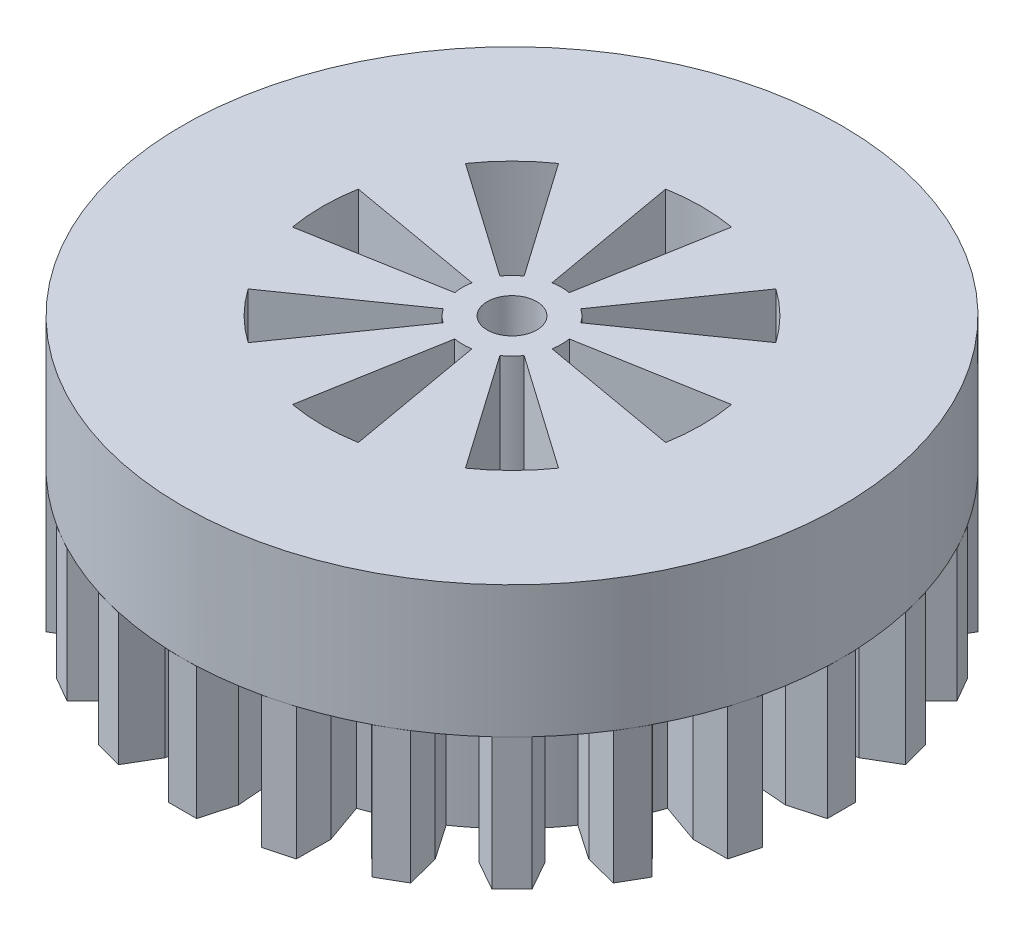
from build123d import *
from build123d.topology import SkipClean

# Parameters (mm, degrees)
SKETCH1_R           = 15.5
BOSS_EXTRUDE1_DEPTH = 8
BOSS_EXTRUDE2_START = -8
BOSS_EXTRUDE2_DEPTH = 8
CHAMFER1_SIZE       = 2
CHAMFER1_SIZE2      = 0.709896962
CHAMFER2_SIZE       = 2
CHAMFER2_SIZE2      = 0.709896962
CIRPATTERN1_DEPTH   = 8
SKETCH3_R           = 20
BOSS_EXTRUDE3_DEPTH = 8
SKETCH4_R           = 3
BOSS_EXTRUDE4_DEPTH = 7
CUT_EXTRUDE1_DEPTH  = 33.496153619
CIRPATTERN2_COUNT   = 8
SKETCH6_R           = 1.5
CUT_EXTRUDE2_DEPTH  = 37.455452267


# Read off the part's stored shape, not the designer's step: CirPattern1
with BuildPart() as part:
    # Sketch1 → Boss-Extrude1 (new body)
    with BuildSketch(Plane(origin=(0, 0, 0), x_dir=(1, 0, 0), z_dir=(0, 1, 0))):
        with Locations(Location((0, 0, 0), (0, 0, 270))):
            Circle(SKETCH1_R)
    extrude(amount=BOSS_EXTRUDE1_DEPTH)

    # Sketch2 → Boss-Extrude2 (add)
    with BuildSketch(Plane(origin=(0, 8, 0), x_dir=(1, 0, 0), z_dir=(0, 1, 0)).offset(BOSS_EXTRUDE2_START)):
        with BuildLine():
            ThreePointArc((-15.452462155, -1.213018279), (-15.488110979, -0.60697471), (-15.5, 0))
            Line((-15.5, 0), (-20, 0))
            Line((-20, 0), (-20, -1.57))
            Line((-20, -1.57), (-15.452462155, -1.213018279))
        make_face()
        with BuildLine():
            Line((-20, 0), (-15.5, 0))
            ThreePointArc((-15.5, 0), (-15.488110979, 0.60697471), (-15.452462155, 1.213018279))
            Line((-15.452462155, 1.213018279), (-20, 1.57))
            Line((-20, 1.57), (-20, 0))
        make_face()
        with BuildLine():
            Line((-15.5, 0), (0, 0))
            Line((0, 0), (-15.452462155, 1.213018279))
            ThreePointArc((-15.452462155, 1.213018279), (-15.488110979, 0.60697471), (-15.5, 0))
        make_face()
        with BuildLine():
            Line((-15.452462155, -1.213018279), (0, 0))
            Line((0, 0), (-15.5, 0))
            ThreePointArc((-15.5, 0), (-15.488110979, -0.60697471), (-15.452462155, -1.213018279))
        make_face()
    extrude(amount=BOSS_EXTRUDE2_DEPTH)

    # Chamfer1
    chamfer1_edges = [part.edges().sort_by_distance(p)[0] for p in [
        (-20, 4, 1.57),
    ]]
    chamfer1_side = [part.faces().sort_by_distance(p)[0] for p in [
        (-17.726231078, 4, 1.39150914),
    ]]
    chamfer(chamfer1_edges, length=CHAMFER1_SIZE, length2=CHAMFER1_SIZE2, reference=chamfer1_side[0])

    # Chamfer2
    chamfer2_edges = [part.edges().sort_by_distance(p)[0] for p in [
        (-20, 4, -1.57),
    ]]
    chamfer2_side = [part.faces().sort_by_distance(p)[0] for p in [
        (-17.726231078, 4, -1.39150914),
    ]]
    chamfer(chamfer2_edges, length=CHAMFER2_SIZE, length2=CHAMFER2_SIZE2, reference=chamfer2_side[0])

    # CirPattern1 outline → CirPattern1 (add)
    with BuildSketch(Plane(origin=(0, 0, 0), x_dir=(1, 0, 0), z_dir=(0, 1, 0))):
        with BuildLine():
            Line((-19.095905479, -6.007176639), (-17.026753845, -6.025648684))
            Line((-17.026753845, -6.025648684), (-14.611980043, -5.171077183))
            ThreePointArc((-14.611980043, -5.171077183), (-14.971850307, -4.011695199), (-15.239884508, -2.827705816))
            Line((-15.239884508, -2.827705816), (-17.758425716, -3.295012088))
            Line((-17.758425716, -3.295012088), (-19.541127573, -4.345585165))
            Line((-19.541127573, -4.345585165), (-19.095905479, -6.007176639))
        make_face()
        with BuildLine():
            ThreePointArc((-15.239884508, 2.827705816), (-14.971850307, 4.011695199), (-14.611980043, 5.171077183))
            Line((-14.611980043, 5.171077183), (-17.026753845, 6.025648684))
            Line((-17.026753845, 6.025648684), (-19.095905479, 6.007176639))
            Line((-19.095905479, 6.007176639), (-19.541127573, 4.345585165))
            Line((-19.541127573, 4.345585165), (-17.758425716, 3.295012088))
            Line((-17.758425716, 3.295012088), (-15.239884508, 2.827705816))
        make_face()
        with BuildLine():
            ThreePointArc((-13.988733917, 6.675726433), (-13.423393758, 7.75), (-12.775715638, 8.776735723))
            Line((-12.775715638, 8.776735723), (-14.887028639, 10.227177855))
            Line((-14.887028639, 10.227177855), (-16.890456557, 10.74487108))
            Line((-16.890456557, 10.74487108), (-17.750559595, 9.25512892))
            Line((-17.750559595, 9.25512892), (-16.300510151, 7.77895606))
            Line((-16.300510151, 7.77895606), (-13.988733917, 6.675726433))
        make_face()
        with BuildLine():
            ThreePointArc((-11.784274227, 10.068807325), (-10.960155108, 10.960155108), (-10.068807325, 11.784274227))
            Line((-10.068807325, 11.784274227), (-11.732777032, 13.731741757))
            Line((-11.732777032, 13.731741757), (-13.533950933, 14.750320314))
            Line((-13.533950933, 14.750320314), (-14.750320314, 13.533950933))
            Line((-14.750320314, 13.533950933), (-13.731741757, 11.732777032))
            Line((-13.731741757, 11.732777032), (-11.784274227, 10.068807325))
        make_face()
        with BuildLine():
            ThreePointArc((-8.776735723, 12.775715638), (-7.75, 13.423393758), (-6.675726433, 13.988733917))
            Line((-6.675726433, 13.988733917), (-7.77895606, 16.300510151))
            Line((-7.77895606, 16.300510151), (-9.25512892, 17.750559595))
            Line((-9.25512892, 17.750559595), (-10.74487108, 16.890456557))
            Line((-10.74487108, 16.890456557), (-10.227177855, 14.887028639))
            Line((-10.227177855, 14.887028639), (-8.776735723, 12.775715638))
        make_face()
        with BuildLine():
            ThreePointArc((-5.171077183, 14.611980043), (-4.011695199, 14.971850307), (-2.827705816, 15.239884508))
            Line((-2.827705816, 15.239884508), (-3.295012088, 17.758425716))
            Line((-3.295012088, 17.758425716), (-4.345585165, 19.541127573))
            Line((-4.345585165, 19.541127573), (-6.007176639, 19.095905479))
            Line((-6.007176639, 19.095905479), (-6.025648684, 17.026753845))
            Line((-6.025648684, 17.026753845), (-5.171077183, 14.611980043))
        make_face()
        with BuildLine():
            ThreePointArc((-1.213018279, 15.452462155), (0, 15.5), (1.213018279, 15.452462155))
            Line((1.213018279, 15.452462155), (1.413481512, 18.006133915))
            Line((1.413481512, 18.006133915), (0.860103038, 20))
            Line((0.860103038, 20), (-0.860103038, 20))
            Line((-0.860103038, 20), (-1.413481512, 18.006133915))
            Line((-1.413481512, 18.006133915), (-1.213018279, 15.452462155))
        make_face()
        with BuildLine():
            ThreePointArc((2.827705816, 15.239884508), (4.011695199, 14.971850307), (5.171077183, 14.611980043))
            Line((5.171077183, 14.611980043), (6.025648684, 17.026753845))
            Line((6.025648684, 17.026753845), (6.007176639, 19.095905479))
            Line((6.007176639, 19.095905479), (4.345585165, 19.541127573))
            Line((4.345585165, 19.541127573), (3.295012088, 17.758425716))
            Line((3.295012088, 17.758425716), (2.827705816, 15.239884508))
        make_face()
        with BuildLine():
            ThreePointArc((6.675726433, 13.988733917), (7.75, 13.423393758), (8.776735723, 12.775715638))
            Line((8.776735723, 12.775715638), (10.227177855, 14.887028639))
            Line((10.227177855, 14.887028639), (10.74487108, 16.890456557))
            Line((10.74487108, 16.890456557), (9.25512892, 17.750559595))
            Line((9.25512892, 17.750559595), (7.77895606, 16.300510151))
            Line((7.77895606, 16.300510151), (6.675726433, 13.988733917))
        make_face()
        with BuildLine():
            ThreePointArc((10.068807325, 11.784274227), (10.960155108, 10.960155108), (11.784274227, 10.068807325))
            Line((11.784274227, 10.068807325), (13.731741757, 11.732777032))
            Line((13.731741757, 11.732777032), (14.750320314, 13.533950933))
            Line((14.750320314, 13.533950933), (13.533950933, 14.750320314))
            Line((13.533950933, 14.750320314), (11.732777032, 13.731741757))
            Line((11.732777032, 13.731741757), (10.068807325, 11.784274227))
        make_face()
        with BuildLine():
            ThreePointArc((12.775715638, 8.776735723), (13.423393759, 7.75), (13.988733917, 6.675726433))
            Line((13.988733917, 6.675726433), (16.300510151, 7.77895606))
            Line((16.300510151, 7.77895606), (17.750559595, 9.25512892))
            Line((17.750559595, 9.25512892), (16.890456557, 10.74487108))
            Line((16.890456557, 10.74487108), (14.887028639, 10.227177855))
            Line((14.887028639, 10.227177855), (12.775715638, 8.776735723))
        make_face()
        with BuildLine():
            ThreePointArc((14.611980043, 5.171077183), (14.971850307, 4.011695199), (15.239884508, 2.827705816))
            Line((15.239884508, 2.827705816), (17.758425716, 3.295012088))
            Line((17.758425716, 3.295012088), (19.541127573, 4.345585165))
            Line((19.541127573, 4.345585165), (19.095905479, 6.007176639))
            Line((19.095905479, 6.007176639), (17.026753845, 6.025648684))
            Line((17.026753845, 6.025648684), (14.611980043, 5.171077183))
        make_face()
        with BuildLine():
            ThreePointArc((15.452462155, 1.213018279), (15.5, 0), (15.452462155, -1.213018279))
            Line((15.452462155, -1.213018279), (18.006133915, -1.413481512))
            Line((18.006133915, -1.413481512), (20, -0.860103038))
            Line((20, -0.860103038), (20, 0.860103038))
            Line((20, 0.860103038), (18.006133915, 1.413481512))
            Line((18.006133915, 1.413481512), (15.452462155, 1.213018279))
        make_face()
        with BuildLine():
            ThreePointArc((15.239884508, -2.827705816), (14.971850307, -4.011695199), (14.611980043, -5.171077183))
            Line((14.611980043, -5.171077183), (17.026753845, -6.025648684))
            Line((17.026753845, -6.025648684), (19.095905479, -6.007176639))
            Line((19.095905479, -6.007176639), (19.541127573, -4.345585165))
            Line((19.541127573, -4.345585165), (17.758425716, -3.295012088))
            Line((17.758425716, -3.295012088), (15.239884508, -2.827705816))
        make_face()
        with BuildLine():
            ThreePointArc((13.988733917, -6.675726433), (13.423393759, -7.75), (12.775715638, -8.776735723))
            Line((12.775715638, -8.776735723), (14.887028639, -10.227177855))
            Line((14.887028639, -10.227177855), (16.890456557, -10.74487108))
            Line((16.890456557, -10.74487108), (17.750559595, -9.25512892))
            Line((17.750559595, -9.25512892), (16.300510151, -7.77895606))
            Line((16.300510151, -7.77895606), (13.988733917, -6.675726433))
        make_face()
        with BuildLine():
            ThreePointArc((11.784274227, -10.068807325), (10.960155108, -10.960155108), (10.068807325, -11.784274227))
            Line((10.068807325, -11.784274227), (11.732777032, -13.731741757))
            Line((11.732777032, -13.731741757), (13.533950933, -14.750320314))
            Line((13.533950933, -14.750320314), (14.750320314, -13.533950933))
            Line((14.750320314, -13.533950933), (13.731741757, -11.732777032))
            Line((13.731741757, -11.732777032), (11.784274227, -10.068807325))
        make_face()
        with BuildLine():
            ThreePointArc((8.776735723, -12.775715638), (7.75, -13.423393758), (6.675726433, -13.988733917))
            Line((6.675726433, -13.988733917), (7.77895606, -16.300510151))
            Line((7.77895606, -16.300510151), (9.25512892, -17.750559595))
            Line((9.25512892, -17.750559595), (10.74487108, -16.890456557))
            Line((10.74487108, -16.890456557), (10.227177855, -14.887028639))
            Line((10.227177855, -14.887028639), (8.776735723, -12.775715638))
        make_face()
        with BuildLine():
            ThreePointArc((5.171077183, -14.611980043), (4.011695199, -14.971850307), (2.827705816, -15.239884508))
            Line((2.827705816, -15.239884508), (3.295012088, -17.758425716))
            Line((3.295012088, -17.758425716), (4.345585165, -19.541127573))
            Line((4.345585165, -19.541127573), (6.007176639, -19.095905479))
            Line((6.007176639, -19.095905479), (6.025648684, -17.026753845))
            Line((6.025648684, -17.026753845), (5.171077183, -14.611980043))
        make_face()
        with BuildLine():
            ThreePointArc((1.213018279, -15.452462155), (0, -15.5), (-1.213018279, -15.452462155))
            Line((-1.213018279, -15.452462155), (-1.413481512, -18.006133915))
            Line((-1.413481512, -18.006133915), (-0.860103038, -20))
            Line((-0.860103038, -20), (0.860103038, -20))
            Line((0.860103038, -20), (1.413481512, -18.006133915))
            Line((1.413481512, -18.006133915), (1.213018279, -15.452462155))
        make_face()
        with BuildLine():
            ThreePointArc((-2.827705816, -15.239884508), (-4.011695199, -14.971850307), (-5.171077183, -14.611980043))
            Line((-5.171077183, -14.611980043), (-6.025648684, -17.026753845))
            Line((-6.025648684, -17.026753845), (-6.007176639, -19.095905479))
            Line((-6.007176639, -19.095905479), (-4.345585165, -19.541127573))
            Line((-4.345585165, -19.541127573), (-3.295012088, -17.758425716))
            Line((-3.295012088, -17.758425716), (-2.827705816, -15.239884508))
        make_face()
        with BuildLine():
            ThreePointArc((-6.675726433, -13.988733917), (-7.75, -13.423393758), (-8.776735723, -12.775715638))
            Line((-8.776735723, -12.775715638), (-10.227177855, -14.887028639))
            Line((-10.227177855, -14.887028639), (-10.74487108, -16.890456557))
            Line((-10.74487108, -16.890456557), (-9.25512892, -17.750559595))
            Line((-9.25512892, -17.750559595), (-7.77895606, -16.300510151))
            Line((-7.77895606, -16.300510151), (-6.675726433, -13.988733917))
        make_face()
        with BuildLine():
            ThreePointArc((-10.068807325, -11.784274227), (-10.960155108, -10.960155108), (-11.784274227, -10.068807325))
            Line((-11.784274227, -10.068807325), (-13.731741757, -11.732777032))
            Line((-13.731741757, -11.732777032), (-14.750320314, -13.533950933))
            Line((-14.750320314, -13.533950933), (-13.533950933, -14.750320314))
            Line((-13.533950933, -14.750320314), (-11.732777032, -13.731741757))
            Line((-11.732777032, -13.731741757), (-10.068807325, -11.784274227))
        make_face()
        with BuildLine():
            ThreePointArc((-12.775715638, -8.776735723), (-13.423393758, -7.75), (-13.988733917, -6.675726433))
            Line((-13.988733917, -6.675726433), (-16.300510151, -7.77895606))
            Line((-16.300510151, -7.77895606), (-17.750559595, -9.25512892))
            Line((-17.750559595, -9.25512892), (-16.890456557, -10.74487108))
            Line((-16.890456557, -10.74487108), (-14.887028639, -10.227177855))
            Line((-14.887028639, -10.227177855), (-12.775715638, -8.776735723))
        make_face()
    extrude(amount=CIRPATTERN1_DEPTH)

    # Sketch3 → Boss-Extrude3 (add)
    with BuildSketch(Plane(origin=(0, 8, 0), x_dir=(1, 0, 0), z_dir=(0, 1, 0))):
        with Locations(Location((0, 0, 0), (0, 0, 270))):
            Circle(SKETCH3_R)
    extrude(amount=BOSS_EXTRUDE3_DEPTH)

    # Sketch4 → Boss-Extrude4 (add)
    with BuildSketch(Plane.XZ):
        with Locations(Location((0, 0, 0), (0, 0, 90))):
            Circle(SKETCH4_R)
    extrude(amount=BOSS_EXTRUDE4_DEPTH)

    # Sketch5 → Cut-Extrude1 (cut, through all)
    with BuildSketch(Plane.XZ):
        with BuildLine():
            ThreePointArc((-2.954423259, -0.520944533), (-3, 0), (-2.954423259, 0.520944533))
            Line((-2.954423259, 0.520944533), (-11.32528916, 1.996954043))
            ThreePointArc((-11.32528916, 1.996954043), (-11.5, 0), (-11.32528916, -1.996954043))
            Line((-11.32528916, -1.996954043), (-2.954423259, -0.520944533))
        make_face()
    cut_extrude1 = extrude(amount=-CUT_EXTRUDE1_DEPTH, mode=Mode.SUBTRACT)

    # CirPattern2: Cut-Extrude1 ×8 about axis
    with SkipClean():  # the faces are left unmerged after this step: merging them gives an invalid solid
        cirpattern2_axis = Axis((0, 0, 0), (0, 1, 0))
        for i in range(1, CIRPATTERN2_COUNT):
            add(cut_extrude1.rotate(cirpattern2_axis, i * 360 / CIRPATTERN2_COUNT), mode=Mode.SUBTRACT)

    # Sketch6 → Cut-Extrude2 (cut, through all)
    with SkipClean():  # the faces are left unmerged after this step: merging them gives an invalid solid
        with BuildSketch(Plane.XZ.offset(7)):
            with Locations(Location((0, 0, 0), (0, 0, 270))):
                Circle(SKETCH6_R)
        extrude(amount=-CUT_EXTRUDE2_DEPTH, mode=Mode.SUBTRACT)


solid = part.part
